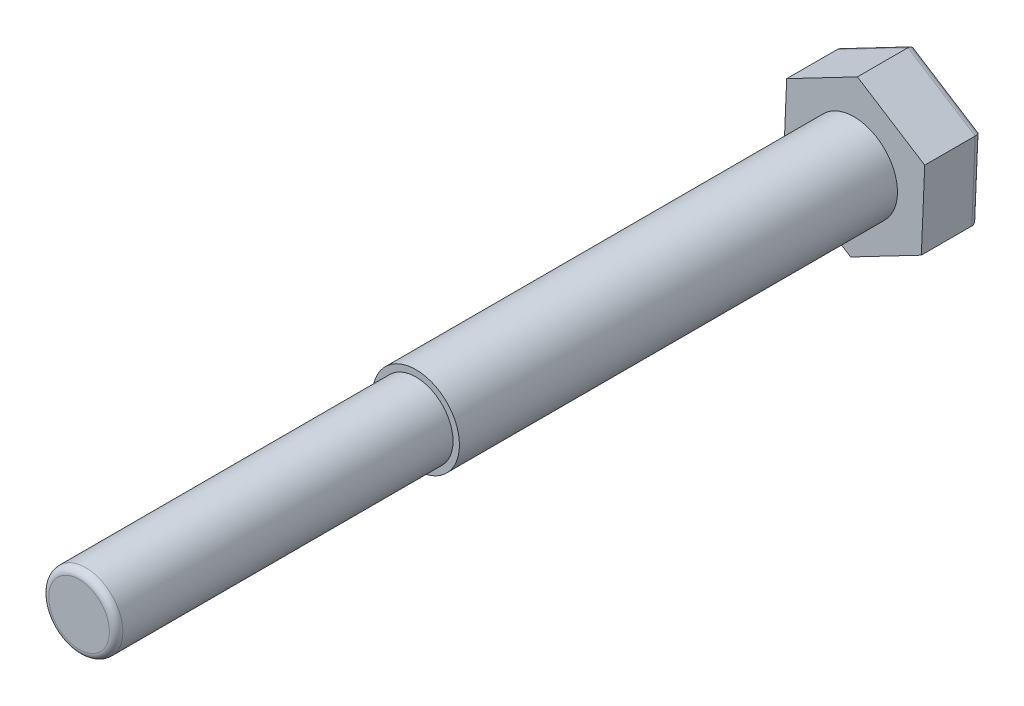
from build123d import *

# Parameters (mm, degrees)
EXTRUDE_305_DEPTH = 17
SKETCH_2_R        = 12.9
EXTRUDE_1_DEPTH   = 130
FILLET_3_R        = 2
SKETCH_3_R        = 11
EXTRUDE_2_DEPTH   = 100
FILLET_4_R        = 2


with BuildPart() as part:
    # 草图1 → Extrude 305 (new body)
    with BuildSketch(Plane.XY):
        Polygon((20.984201837, 10.954296262), (1.005402075, 23.65), (-19.978799762, 12.695703738), (-20.984201837, -10.954296262), (-1.005402075, -23.65), (19.978799762, -12.695703738), align=None)
    extrude(amount=EXTRUDE_305_DEPTH)

    # 草图2 → 凸台-拉伸1 (add)
    with BuildSketch(Plane.XY.offset(17)):
        Circle(SKETCH_2_R)
    extrude(amount=EXTRUDE_1_DEPTH)

    # 圆角3
    fillet_3_edges = [part.edges().sort_by_distance(p)[0] for p in [
        (10.994801956, 17.302148131, 0),
        (-9.486698843, 18.172851869, 0),
        (-20.4815008, 0.870703738, 0),
        (-10.994801956, -17.302148131, 0),
        (9.486698843, -18.172851869, 0),
        (20.4815008, -0.870703738, 0),
    ]]
    fillet(fillet_3_edges, radius=FILLET_3_R)

    # 草图3 → 凸台-拉伸2 (add)
    with BuildSketch(Plane.XY.offset(147)):
        Circle(SKETCH_3_R)
    extrude(amount=EXTRUDE_2_DEPTH)

    # 圆角4
    fillet_4_edges = [part.edges().sort_by_distance(p)[0] for p in [
        (-11, 0, 247),
    ]]
    fillet(fillet_4_edges, radius=FILLET_4_R)


solid = part.part
